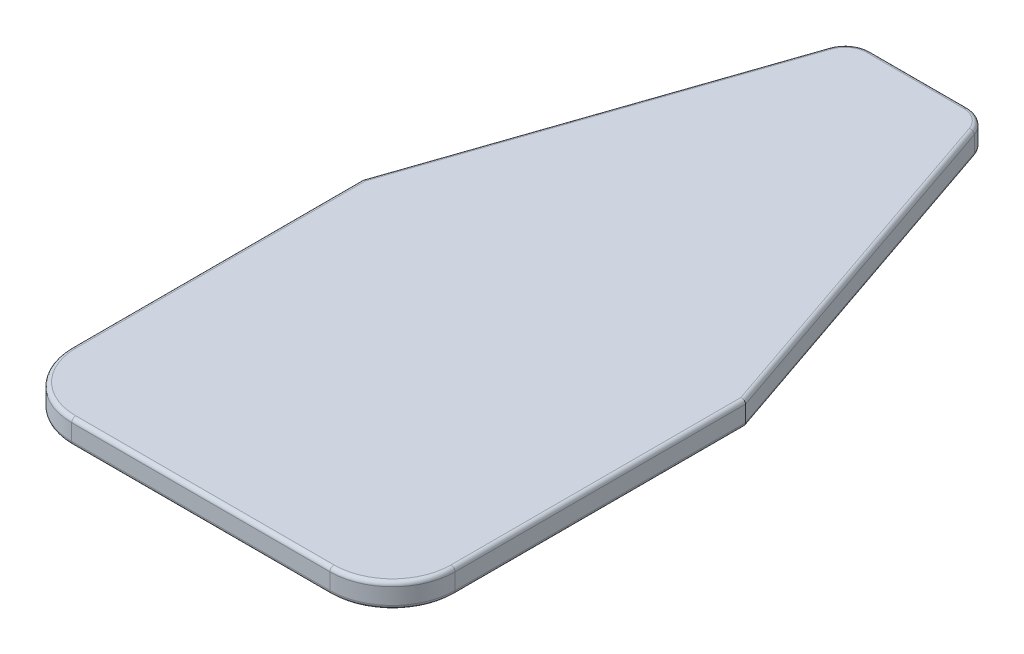
from build123d import *

# Parameters (mm, degrees)
BOSS_EXTRUDE1_DEPTH = 19.05
FILLET1_R           = 3.175
FILLET2_R           = 3.175


with BuildPart() as part:
    # Sketch1 → Boss-Extrude1 (new body)
    with BuildSketch(Plane(origin=(0, 0, 0), x_dir=(1, 0, 0), z_dir=(0, 1, 0))):
        with BuildLine():
            Line((-101.6, -24.364478091), (101.6, -24.364478091))
            ThreePointArc((101.6, -24.364478091), (136.398492469, -9.95047056), (150.8125, 24.848021909))
            Line((150.8125, 24.848021909), (150.8125, 253.448021909))
            Line((150.8125, 253.448021909), (57.15, 527.169679348))
            ThreePointArc((57.15, 527.169679348), (49.807835716, 537.031618051), (38.1, 540.785521909))
            Line((38.1, 540.785521909), (-38.1, 540.785521909))
            ThreePointArc((-38.1, 540.785521909), (-49.807835716, 537.031618051), (-57.15, 527.169679348))
            Line((-57.15, 527.169679348), (-150.8125, 253.448021909))
            Line((-150.8125, 253.448021909), (-150.8125, 24.848021909))
            ThreePointArc((-150.8125, 24.848021909), (-136.398492469, -9.95047056), (-101.6, -24.364478091))
        make_face()
    extrude(amount=BOSS_EXTRUDE1_DEPTH)

    # Fillet1
    fillet1_edges = [part.edges().sort_by_distance(p)[0] for p in [
        (-103.98125, 19.05, -390.308850629),
        (-49.807835716, 19.05, -537.031618051),
        (0, 19.05, -540.785521909),
        (49.807835716, 19.05, -537.031618051),
        (-150.8125, 19.05, -139.148021909),
        (-136.398492469, 19.05, 9.95047056),
        (0, 19.05, 24.364478091),
        (136.398492469, 19.05, 9.95047056),
        (103.98125, 19.05, -390.308850629),
        (150.8125, 19.05, -139.148021909),
    ]]
    fillet(fillet1_edges, radius=FILLET1_R)

    # Fillet2
    fillet2_edges = [part.edges().sort_by_distance(p)[0] for p in [
        (103.98125, 0, -390.308850629),
        (49.807835716, 0, -537.031618051),
        (0, 0, -540.785521909),
        (-49.807835716, 0, -537.031618051),
        (-150.8125, 0, -139.148021909),
        (-136.398492469, 0, 9.95047056),
        (150.8125, 0, -139.148021909),
        (136.398492469, 0, 9.95047056),
        (-103.98125, 0, -390.308850629),
        (0, 0, 24.364478091),
    ]]
    fillet(fillet2_edges, radius=FILLET2_R)


solid = part.part
